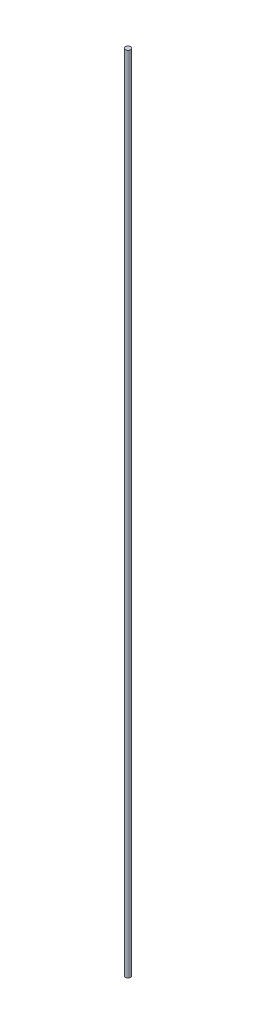
from build123d import *

# Parameters (mm, degrees)
SKETCH_2_W = 2.5
SKETCH_2_H = 760


with BuildPart() as part:
    # Эскиз2 → Повернуть1 (revolve)
    with BuildSketch(Plane.XY):
        with Locations((-1.25, 0)):
            Rectangle(SKETCH_2_W, SKETCH_2_H)
    revolve(axis=Axis((-2.5, 380, 0), (0, -1, 0)))


solid = part.part
